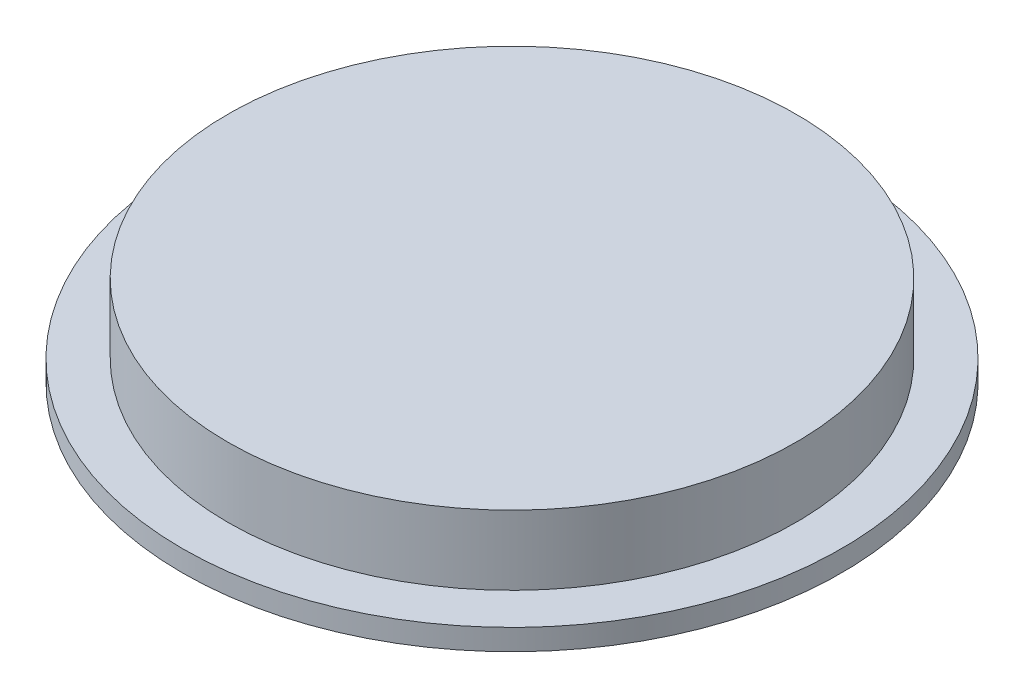
from build123d import *


with BuildPart() as part:
    # Sketch1 → Revolve1 (revolve)
    with BuildSketch(Plane.XY):
        Polygon((0, 13.516872382), (51.971626824, 13.516872382), (51.971626824, 0.816872382), (60.278988403, 0.816872382), (60.278988403, -3.036746306), (47.15983465, -3.036746306), (38.1, 1.670674941), (0, 1.670674941), align=None)
    revolve(axis=Axis((0, 45.293153527, 0), (0, -1, 0)))


solid = part.part
